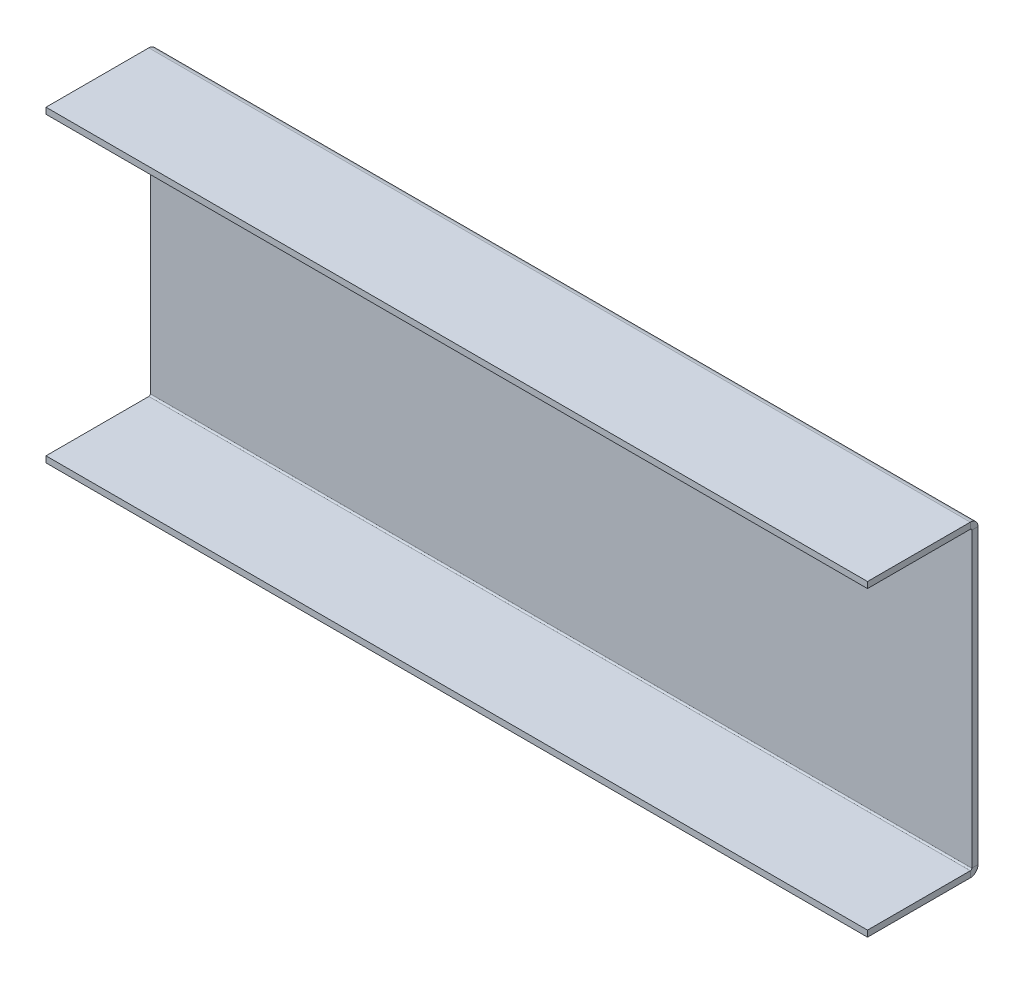
from build123d import *

# Parameters (mm, degrees)
SKETCH1_W                    = 400
SKETCH1_H                    = 150
BASE_FLANGE1_DEPTH           = 3
EDGE_FLANGE1_STRIP_W         = 13.4732
EDGE_FLANGE1_STRIP_H         = 3
EDGE_FLANGE1_STRIP_CUT_DEPTH = 400
EDGE_FLANGE1_DEPTH           = 400
EDGE_FLANGE2_STRIP_W         = 13.4732
EDGE_FLANGE2_STRIP_H         = 3
EDGE_FLANGE2_STRIP_CUT_DEPTH = 400
EDGE_FLANGE2_DEPTH           = 400


# Sheet-metal steps are written as plain solids
with BuildPart() as part:
    # Sketch1 → Base-Flange1 (new body)
    with BuildSketch(Plane.XY):
        Rectangle(SKETCH1_W, SKETCH1_H)
    extrude(amount=-BASE_FLANGE1_DEPTH)

    # Edge-Flange1 strip (across the edge) → Edge-Flange1 strip cut (cut)
    with BuildSketch(Plane(origin=(-200, -75, 0), x_dir=(0, 1, 0), z_dir=(1, 0, 0))):
        with Locations((-3, -1.5)):
            Rectangle(EDGE_FLANGE1_STRIP_W, EDGE_FLANGE1_STRIP_H)
    extrude(amount=EDGE_FLANGE1_STRIP_CUT_DEPTH, mode=Mode.SUBTRACT)

    # Edge-Flange1 section (across the edge) → Edge-Flange1 (add)
    with BuildSketch(Plane(origin=(-200, -75, 0), x_dir=(0, 1, 0), z_dir=(1, 0, 0))):
        with BuildLine():
            Line((0, 0.7366), (0, 50.8))
            Line((0, 50.8), (3, 50.8))
            Line((3, 50.8), (3, 0.7366))
            ThreePointArc((3, 0.7366), (3.215745145, 0.215745145), (3.7366, 0))
            Line((3.7366, 0), (3.7366, -3))
            ThreePointArc((3.7366, -3), (1.094424801, -1.905575199), (0, 0.7366))
        make_face()
    extrude(amount=EDGE_FLANGE1_DEPTH)

    # Edge-Flange2 strip (across the edge) → Edge-Flange2 strip cut (cut)
    with BuildSketch(Plane(origin=(200, 75, 0), x_dir=(0, -1, 0), z_dir=(-1, 0, 0))):
        with Locations((-3, -1.5)):
            Rectangle(EDGE_FLANGE2_STRIP_W, EDGE_FLANGE2_STRIP_H)
    extrude(amount=EDGE_FLANGE2_STRIP_CUT_DEPTH, mode=Mode.SUBTRACT)

    # Edge-Flange2 section (across the edge) → Edge-Flange2 (add)
    with BuildSketch(Plane(origin=(200, 75, 0), x_dir=(0, -1, 0), z_dir=(-1, 0, 0))):
        with BuildLine():
            Line((0, 0.7366), (0, 50.8))
            Line((0, 50.8), (3, 50.8))
            Line((3, 50.8), (3, 0.7366))
            ThreePointArc((3, 0.7366), (3.215745145, 0.215745145), (3.7366, 0))
            Line((3.7366, 0), (3.7366, -3))
            ThreePointArc((3.7366, -3), (1.094424801, -1.905575199), (0, 0.7366))
        make_face()
    extrude(amount=EDGE_FLANGE2_DEPTH)


solid = part.part
